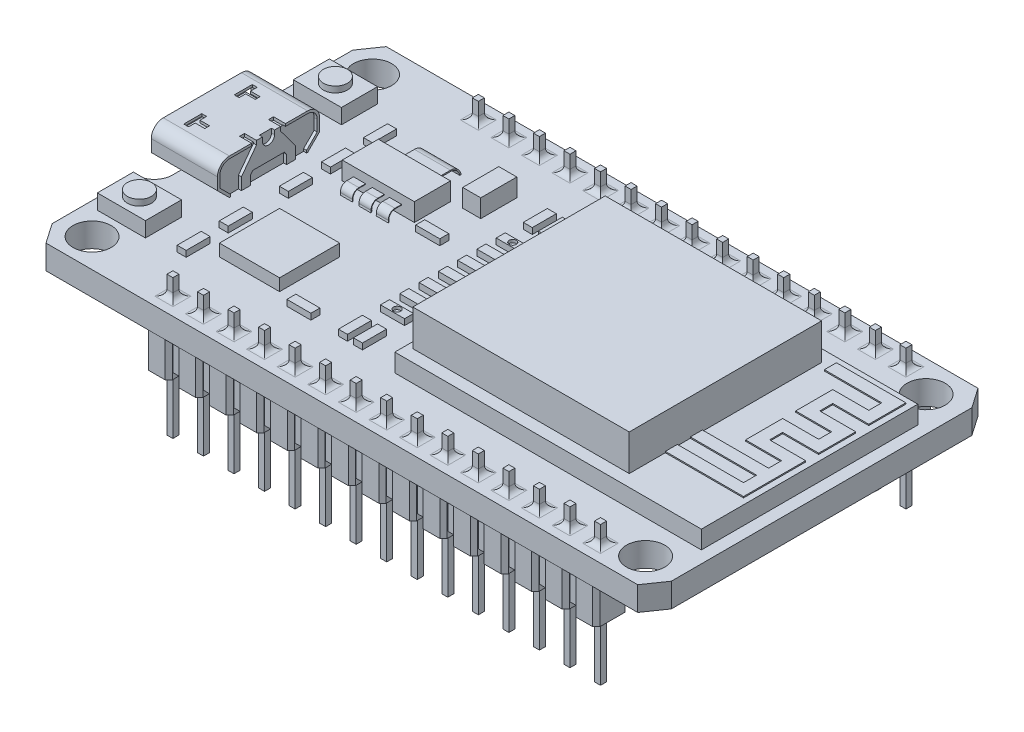
from build123d import *

# Parameters (mm, degrees)
CROQUIS1_W                = 51.5
CROQUIS1_H                = 28.3
SALIENTE_EXTRUIR1_DEPTH   = 2
CROQUIS2_R                = 1.5875
CORTAR_EXTRUIR1_DEPTH     = 2
CROQUIS13_OUTSIDE_W       = 65.26
CROQUIS13_OUTSIDE_H       = 42.06
CORTAR_EXTRUIR2_DEPTH     = 3
CROQUIS3_W                = 25.5
CROQUIS3_H                = 18
SALIENTE_EXTRUIR2_DEPTH   = 1.5
CROQUIS4_W                = 18
CROQUIS4_H                = 16
SALIENTE_EXTRUIR3_DEPTH   = 3
SALIENTE_EXTRUIR4_START   = -10
CROQUIS5_W                = 0.5
CROQUIS5_H                = 0.5
SALIENTE_EXTRUIR4_DEPTH   = 11.5875
CROQUIS6_W                = 2
CROQUIS6_H                = 2.7
SALIENTE_EXTRUIR5_DEPTH   = 3
CHAFL_N1_SIZE             = 0.3
REDONDEO2_R               = 0.5
MATRIZL1_COUNT            = 15
MATRIZL1_PITCH            = 2.54
CHAFL_N1_OF_MATRIZL1_SIZE = 0.3
REDONDEO2_OF_MATRIZL1_R   = 0.5
CROQUIS8_W                = 37.56
CROQUIS8_H                = 2
SALIENTE_EXTRUIR6_DEPTH   = 2.5
CROQUIS12_W               = 5.5
CROQUIS12_H               = 8.5
SALIENTE_EXTRUIR9_DEPTH   = 3
REDONDEO1_R               = 1
CORTAR_EXTRUIR3_DEPTH     = 6
CORTAR_EXTRUIR4_DEPTH     = 4
CORTAR_EXTRUIR5_START     = -0.25
CORTAR_EXTRUIR5_DEPTH     = 0.25
CROQUIS17_W               = 1
CROQUIS17_H               = 0.411065286
CORTAR_EXTRUIR6_DEPTH     = 0.25
CROQUIS18_W               = 5.68961293
CROQUIS18_H               = 0.758953995
SALIENTE_EXTRUIR10_DEPTH  = 3.25
CROQUIS19_W               = 4
CROQUIS19_H               = 3
SALIENTE_EXTRUIR11_DEPTH  = 1.25
CROQUIS22_R               = 1
SALIENTE_EXTRUIR13_DEPTH  = 0.5
CROQUIS23_W               = 0.75
CROQUIS23_H               = 2
CROQUIS23_W_2             = 2
CROQUIS23_H_2             = 0.75
SALIENTE_EXTRUIR14_DEPTH  = 0.5
CROQUIS26_W               = 5
CROQUIS26_H               = 5
SALIENTE_EXTRUIR15_DEPTH  = 1
CROQUIS27_W               = 1.5
CROQUIS27_H               = 3
SALIENTE_EXTRUIR16_DEPTH  = 1.5
CROQUIS28_W               = 6
CROQUIS28_H               = 3
SALIENTE_EXTRUIR17_DEPTH  = 1.5
SALIENTE_EXTRUIR18_DEPTH  = 0.1
CROQUIS31_R               = 0.3
CORTAR_EXTRUIR7_DEPTH     = 0.25
CROQUIS33_W               = 3
CROQUIS33_H               = 0.1
CROQUIS35_W               = 1
CROQUIS35_H               = 0.05
CORTAR_EXTRUIR8_DEPTH     = 0.5


with BuildPart() as part:
    # Croquis1 → Saliente-Extruir1 (new body)
    with BuildSketch(Plane(origin=(0, 0, 0), x_dir=(1, 0, 0), z_dir=(0, 1, 0))):
        Rectangle(CROQUIS1_W, CROQUIS1_H)
    extrude(amount=SALIENTE_EXTRUIR1_DEPTH)

    # Croquis2 → Cortar-Extruir1 (cut)
    with BuildSketch(Plane(origin=(0, 2, 0), x_dir=(1, 0, 0), z_dir=(0, 1, 0))):
        with Locations((-23.1625, 11.5625)):
            Circle(CROQUIS2_R)
        with Locations((22.875, 11.5625)):
            Circle(CROQUIS2_R)
        with Locations((-23.1625, -11.7625)):
            Circle(CROQUIS2_R)
        with Locations((22.875, -11.7625)):
            Circle(CROQUIS2_R)
    extrude(amount=-CORTAR_EXTRUIR1_DEPTH, mode=Mode.SUBTRACT)

    # Croquis13 outside → Cortar-Extruir2 (cut)
    with BuildSketch(Plane(origin=(0, 2, 0), x_dir=(1, 0, 0), z_dir=(0, 1, 0))):
        Rectangle(CROQUIS13_OUTSIDE_W, CROQUIS13_OUTSIDE_H)
        with BuildLine():
            Line((25.75, 12.5), (25.75, -12.5))
            Line((25.75, -12.5), (24.60625, -14.15))
            Line((24.60625, -14.15), (-24.60625, -14.15))
            Line((-24.60625, -14.15), (-25.75, -12.5))
            Line((-25.75, -12.5), (-25.75, -5.5))
            ThreePointArc((-25.75, -5.5), (-24.689339828, -5.060660172), (-24.25, -4))
            Line((-24.25, -4), (-24.25, 4))
            ThreePointArc((-24.25, 4), (-24.689339828, 5.060660172), (-25.75, 5.5))
            Line((-25.75, 5.5), (-25.75, 12.5))
            Line((-25.75, 12.5), (-24.60625, 14.15))
            Line((-24.60625, 14.15), (24.60625, 14.15))
            Line((24.60625, 14.15), (25.75, 12.5))
        make_face(mode=Mode.SUBTRACT)
    extrude(amount=-CORTAR_EXTRUIR2_DEPTH, mode=Mode.SUBTRACT)

    # Croquis3 → Saliente-Extruir2 (add)
    with BuildSketch(Plane(origin=(0, 2, 0), x_dir=(1, 0, 0), z_dir=(0, 1, 0))):
        with Locations((12, 0)):
            Rectangle(CROQUIS3_W, CROQUIS3_H)
    extrude(amount=SALIENTE_EXTRUIR2_DEPTH)

    # Croquis4 → Saliente-Extruir3 (add)
    with BuildSketch(Plane(origin=(0, 3.5, 0), x_dir=(1, 0, 0), z_dir=(0, 1, 0))):
        with Locations((8.75, 0)):
            Rectangle(CROQUIS4_W, CROQUIS4_H)
    extrude(amount=SALIENTE_EXTRUIR3_DEPTH)

    # Croquis5 → Saliente-Extruir4 (add)
    with BuildSketch(Plane(origin=(0, 2, 0), x_dir=(1, 0, 0), z_dir=(0, 1, 0)).offset(SALIENTE_EXTRUIR4_START)):
        with Locations((-15.5, 12.7)):
            Rectangle(CROQUIS5_W, CROQUIS5_H)
        with Locations((-15.5, -12.7)):
            Rectangle(CROQUIS5_W, CROQUIS5_H)
    saliente_extruir4 = extrude(amount=SALIENTE_EXTRUIR4_DEPTH)

    # Croquis6 → Saliente-Extruir5 (add)
    with BuildSketch(Plane.XZ):
        with Locations((-15.5, -12.7)):
            Rectangle(CROQUIS6_W, CROQUIS6_H)
        with Locations((-15.5, 12.7)):
            Rectangle(CROQUIS6_W, CROQUIS6_H)
    saliente_extruir5 = extrude(amount=SALIENTE_EXTRUIR5_DEPTH)

    # Chaflán1
    chafl_n1_edges = [part.edges().sort_by_distance(p)[0] for p in [
        (-16.5, -1.5, -14.05),
        (-16.5, -1.5, -11.35),
        (-14.5, -1.5, -11.35),
        (-14.5, -1.5, -14.05),
        (-16.5, -1.5, 11.35),
        (-14.5, -1.5, 11.35),
        (-14.5, -1.5, 14.05),
        (-16.5, -1.5, 14.05),
    ]]
    chamfer(chafl_n1_edges, length=CHAFL_N1_SIZE)

    # Redondeo2
    redondeo2_edges = [part.edges().sort_by_distance(p)[0] for p in [
        (-15.75, 2, -12.7),
        (-15.5, 2, -12.45),
        (-15.25, 2, -12.7),
        (-15.5, 2, -12.95),
        (-15.25, 2, 12.7),
        (-15.5, 2, 12.95),
        (-15.5, 2, 12.45),
        (-15.75, 2, 12.7),
    ]]
    fillet(redondeo2_edges, radius=REDONDEO2_R)

    # MatrizL1: Saliente-Extruir4, Saliente-Extruir5 ×15
    with Locations(*[(i * MATRIZL1_PITCH, 0, 0) for i in range(1, MATRIZL1_COUNT)]):
        add(saliente_extruir4)
        add(saliente_extruir5)

    # Chaflán1 of MatrizL1
    chafl_n1_of_matrizl1_edges = [part.edges().sort_by_distance(p)[0] for p in [
        (-13.96, -1.5, -14.05),
        (-13.96, -1.5, -11.35),
        (-11.96, -1.5, -11.35),
        (-11.96, -1.5, -14.05),
        (-13.96, -1.5, 11.35),
        (-11.96, -1.5, 11.35),
        (-11.96, -1.5, 14.05),
        (-13.96, -1.5, 14.05),
        (-11.42, -1.5, -14.05),
        (-11.42, -1.5, -11.35),
        (-9.42, -1.5, -11.35),
        (-9.42, -1.5, -14.05),
        (-11.42, -1.5, 11.35),
        (-9.42, -1.5, 11.35),
        (-9.42, -1.5, 14.05),
        (-11.42, -1.5, 14.05),
        (-8.88, -1.5, -14.05),
        (-8.88, -1.5, -11.35),
        (-6.88, -1.5, -11.35),
        (-6.88, -1.5, -14.05),
        (-8.88, -1.5, 11.35),
        (-6.88, -1.5, 11.35),
        (-6.88, -1.5, 14.05),
        (-8.88, -1.5, 14.05),
        (-6.34, -1.5, -14.05),
        (-6.34, -1.5, -11.35),
        (-4.34, -1.5, -11.35),
        (-4.34, -1.5, -14.05),
        (-6.34, -1.5, 11.35),
        (-4.34, -1.5, 11.35),
        (-4.34, -1.5, 14.05),
        (-6.34, -1.5, 14.05),
        (-3.8, -1.5, -14.05),
        (-3.8, -1.5, -11.35),
        (-1.8, -1.5, -11.35),
        (-1.8, -1.5, -14.05),
        (-3.8, -1.5, 11.35),
        (-1.8, -1.5, 11.35),
        (-1.8, -1.5, 14.05),
        (-3.8, -1.5, 14.05),
        (-1.26, -1.5, -14.05),
        (-1.26, -1.5, -11.35),
        (0.74, -1.5, -11.35),
        (0.74, -1.5, -14.05),
        (-1.26, -1.5, 11.35),
        (0.74, -1.5, 11.35),
        (0.74, -1.5, 14.05),
        (-1.26, -1.5, 14.05),
        (1.28, -1.5, -14.05),
        (1.28, -1.5, -11.35),
        (3.28, -1.5, -11.35),
        (3.28, -1.5, -14.05),
        (1.28, -1.5, 11.35),
        (3.28, -1.5, 11.35),
        (3.28, -1.5, 14.05),
        (1.28, -1.5, 14.05),
        (3.82, -1.5, -14.05),
        (3.82, -1.5, -11.35),
        (5.82, -1.5, -11.35),
        (5.82, -1.5, -14.05),
        (3.82, -1.5, 11.35),
        (5.82, -1.5, 11.35),
        (5.82, -1.5, 14.05),
        (3.82, -1.5, 14.05),
        (6.36, -1.5, -14.05),
        (6.36, -1.5, -11.35),
        (8.36, -1.5, -11.35),
        (8.36, -1.5, -14.05),
        (6.36, -1.5, 11.35),
        (8.36, -1.5, 11.35),
        (8.36, -1.5, 14.05),
        (6.36, -1.5, 14.05),
        (8.9, -1.5, -14.05),
        (8.9, -1.5, -11.35),
        (10.9, -1.5, -11.35),
        (10.9, -1.5, -14.05),
        (8.9, -1.5, 11.35),
        (10.9, -1.5, 11.35),
        (10.9, -1.5, 14.05),
        (8.9, -1.5, 14.05),
        (11.44, -1.5, -14.05),
        (11.44, -1.5, -11.35),
        (13.44, -1.5, -11.35),
        (13.44, -1.5, -14.05),
        (11.44, -1.5, 11.35),
        (13.44, -1.5, 11.35),
        (13.44, -1.5, 14.05),
        (11.44, -1.5, 14.05),
        (13.98, -1.5, -14.05),
        (13.98, -1.5, -11.35),
        (15.98, -1.5, -11.35),
        (15.98, -1.5, -14.05),
        (13.98, -1.5, 11.35),
        (15.98, -1.5, 11.35),
        (15.98, -1.5, 14.05),
        (13.98, -1.5, 14.05),
        (16.52, -1.5, -14.05),
        (16.52, -1.5, -11.35),
        (18.52, -1.5, -11.35),
        (18.52, -1.5, -14.05),
        (16.52, -1.5, 11.35),
        (18.52, -1.5, 11.35),
        (18.52, -1.5, 14.05),
        (16.52, -1.5, 14.05),
        (19.06, -1.5, -14.05),
        (19.06, -1.5, -11.35),
        (21.06, -1.5, -11.35),
        (21.06, -1.5, -14.05),
        (19.06, -1.5, 11.35),
        (21.06, -1.5, 11.35),
        (21.06, -1.5, 14.05),
        (19.06, -1.5, 14.05),
    ]]
    chamfer(chafl_n1_of_matrizl1_edges, length=CHAFL_N1_OF_MATRIZL1_SIZE)

    # Redondeo2 of MatrizL1
    redondeo2_of_matrizl1_edges = [part.edges().sort_by_distance(p)[0] for p in [
        (-13.21, 2, -12.7),
        (-12.96, 2, -12.45),
        (-12.71, 2, -12.7),
        (-12.96, 2, -12.95),
        (-12.71, 2, 12.7),
        (-12.96, 2, 12.95),
        (-12.96, 2, 12.45),
        (-13.21, 2, 12.7),
        (-10.67, 2, -12.7),
        (-10.42, 2, -12.45),
        (-10.17, 2, -12.7),
        (-10.42, 2, -12.95),
        (-10.17, 2, 12.7),
        (-10.42, 2, 12.95),
        (-10.42, 2, 12.45),
        (-10.67, 2, 12.7),
        (-8.13, 2, -12.7),
        (-7.88, 2, -12.45),
        (-7.63, 2, -12.7),
        (-7.88, 2, -12.95),
        (-7.63, 2, 12.7),
        (-7.88, 2, 12.95),
        (-7.88, 2, 12.45),
        (-8.13, 2, 12.7),
        (-5.59, 2, -12.7),
        (-5.34, 2, -12.45),
        (-5.09, 2, -12.7),
        (-5.34, 2, -12.95),
        (-5.09, 2, 12.7),
        (-5.34, 2, 12.95),
        (-5.34, 2, 12.45),
        (-5.59, 2, 12.7),
        (-3.05, 2, -12.7),
        (-2.8, 2, -12.45),
        (-2.55, 2, -12.7),
        (-2.8, 2, -12.95),
        (-2.55, 2, 12.7),
        (-2.8, 2, 12.95),
        (-2.8, 2, 12.45),
        (-3.05, 2, 12.7),
        (-0.51, 2, -12.7),
        (-0.26, 2, -12.45),
        (-0.01, 2, -12.7),
        (-0.26, 2, -12.95),
        (-0.01, 2, 12.7),
        (-0.26, 2, 12.95),
        (-0.26, 2, 12.45),
        (-0.51, 2, 12.7),
        (2.03, 2, -12.7),
        (2.28, 2, -12.45),
        (2.53, 2, -12.7),
        (2.28, 2, -12.95),
        (2.53, 2, 12.7),
        (2.28, 2, 12.95),
        (2.28, 2, 12.45),
        (2.03, 2, 12.7),
        (4.57, 2, -12.7),
        (4.82, 2, -12.45),
        (5.07, 2, -12.7),
        (4.82, 2, -12.95),
        (5.07, 2, 12.7),
        (4.82, 2, 12.95),
        (4.82, 2, 12.45),
        (4.57, 2, 12.7),
        (7.11, 2, -12.7),
        (7.36, 2, -12.45),
        (7.61, 2, -12.7),
        (7.36, 2, -12.95),
        (7.61, 2, 12.7),
        (7.36, 2, 12.95),
        (7.36, 2, 12.45),
        (7.11, 2, 12.7),
        (9.65, 2, -12.7),
        (9.9, 2, -12.45),
        (10.15, 2, -12.7),
        (9.9, 2, -12.95),
        (10.15, 2, 12.7),
        (9.9, 2, 12.95),
        (9.9, 2, 12.45),
        (9.65, 2, 12.7),
        (12.19, 2, -12.7),
        (12.44, 2, -12.45),
        (12.69, 2, -12.7),
        (12.44, 2, -12.95),
        (12.69, 2, 12.7),
        (12.44, 2, 12.95),
        (12.44, 2, 12.45),
        (12.19, 2, 12.7),
        (14.73, 2, -12.7),
        (14.98, 2, -12.45),
        (15.23, 2, -12.7),
        (14.98, 2, -12.95),
        (15.23, 2, 12.7),
        (14.98, 2, 12.95),
        (14.98, 2, 12.45),
        (14.73, 2, 12.7),
        (17.27, 2, -12.7),
        (17.52, 2, -12.45),
        (17.77, 2, -12.7),
        (17.52, 2, -12.95),
        (17.77, 2, 12.7),
        (17.52, 2, 12.95),
        (17.52, 2, 12.45),
        (17.27, 2, 12.7),
        (19.81, 2, -12.7),
        (20.06, 2, -12.45),
        (20.31, 2, -12.7),
        (20.06, 2, -12.95),
        (20.31, 2, 12.7),
        (20.06, 2, 12.95),
        (20.06, 2, 12.45),
        (19.81, 2, 12.7),
    ]]
    fillet(redondeo2_of_matrizl1_edges, radius=REDONDEO2_OF_MATRIZL1_R)

    # Croquis8 → Saliente-Extruir6 (add)
    with BuildSketch(Plane.XZ):
        with Locations((2.28, -12.7)):
            Rectangle(CROQUIS8_W, CROQUIS8_H)
        with Locations((2.28, 12.7)):
            Rectangle(CROQUIS8_W, CROQUIS8_H)
    extrude(amount=SALIENTE_EXTRUIR6_DEPTH)

    # Croquis12 → Saliente-Extruir9 (add)
    with BuildSketch(Plane(origin=(0, 2, 0), x_dir=(1, 0, 0), z_dir=(0, 1, 0))):
        with Locations((-23, 0)):
            Rectangle(CROQUIS12_W, CROQUIS12_H)
    extrude(amount=SALIENTE_EXTRUIR9_DEPTH)

    # Redondeo1
    redondeo1_edges = [part.edges().sort_by_distance(p)[0] for p in [
        (-23, 5, 4.25),
        (-23, 5, -4.25),
    ]]
    fillet(redondeo1_edges, radius=REDONDEO1_R)

    # Croquis14 → Cortar-Extruir3 (cut)
    with BuildSketch(Plane.ZY.offset(25.75)):
        Polygon((-4.25, 2), (-3.25, 2), (-4.25, 3), align=None)
        Polygon((4.25, 3), (3.25, 2), (4.25, 2), align=None)
    extrude(amount=-CORTAR_EXTRUIR3_DEPTH, mode=Mode.SUBTRACT)

    # Croquis15 → Cortar-Extruir4 (cut)
    with BuildSketch(Plane.ZY.offset(25.75)):
        with BuildLine():
            Line((-4.05, 3.082842712), (-3.167157288, 2.2))
            Line((-3.167157288, 2.2), (3.167157288, 2.2))
            Line((3.167157288, 2.2), (4.05, 3.082842712))
            Line((4.05, 3.082842712), (4.05, 4))
            ThreePointArc((4.05, 4), (3.815685425, 4.565685425), (3.25, 4.8))
            Line((3.25, 4.8), (-3.25, 4.8))
            ThreePointArc((-3.25, 4.8), (-3.815685425, 4.565685425), (-4.05, 4))
            Line((-4.05, 4), (-4.05, 3.082842712))
        make_face()
    extrude(amount=-CORTAR_EXTRUIR4_DEPTH, mode=Mode.SUBTRACT)

    # Croquis16 → Cortar-Extruir5 (cut)
    with BuildSketch(Plane(origin=(-20.25, 0, 0), x_dir=(0, 0, -1), z_dir=(1, 0, 0)).offset(CORTAR_EXTRUIR5_START)):
        Polygon((-1.5, 2.750073012), (-1.5, 2), (1.5, 2), (1.5, 2.750073012), (1.316867325, 2.994339073), (-1.316867325, 2.994339073), align=None)
        with BuildLine():
            Line((-2.25, 3), (-1, 4.667275256))
            Line((-1, 4.667275256), (-1, 5))
            Line((-1, 5), (-1.411065286, 5))
            Line((-1.411065286, 5), (-1.411065286, 4.8))
            Line((-1.411065286, 4.8), (-3.25, 4.8))
            ThreePointArc((-3.25, 4.8), (-3.815685425, 4.565685425), (-4.05, 4))
            Line((-4.05, 4), (-4.05, 3.082842712))
            Line((-4.05, 3.082842712), (-3.167157288, 2.2))
            Line((-3.167157288, 2.2), (-3.167157288, 2))
            Line((-3.167157288, 2), (-2.25, 2))
            Line((-2.25, 2), (-2.25, 3))
        make_face()
        with BuildLine():
            Line((-0.5, 5), (0.5, 5))
            Line((0.5, 5), (0.5, 4.667275256))
            ThreePointArc((0.5, 4.667275256), (0, 4.167275256), (-0.5, 4.667275256))
            Line((-0.5, 4.667275256), (-0.5, 5))
        make_face()
        with BuildLine():
            Line((3.167157288, 2.2), (3.167157288, 2))
            Line((3.167157288, 2), (2.25, 2))
            Line((2.25, 2), (2.25, 3))
            Line((2.25, 3), (1, 4.667275256))
            Line((1, 4.667275256), (1, 5))
            Line((1, 5), (1.411065286, 5))
            Line((1.411065286, 5), (1.411065286, 4.8))
            Line((1.411065286, 4.8), (3.25, 4.8))
            ThreePointArc((3.25, 4.8), (3.815685425, 4.565685425), (4.05, 4))
            Line((4.05, 4), (4.05, 3.082842712))
            Line((4.05, 3.082842712), (3.167157288, 2.2))
        make_face()
    extrude(amount=CORTAR_EXTRUIR5_DEPTH, mode=Mode.SUBTRACT)

    # Croquis17 → Cortar-Extruir6 (cut)
    with BuildSketch(Plane(origin=(0, 5, 0), x_dir=(1, 0, 0), z_dir=(0, 1, 0))):
        with Locations((-20.75, -1.205532643)):
            Rectangle(CROQUIS17_W, CROQUIS17_H)
        with Locations((-20.75, 1.205532643)):
            Rectangle(CROQUIS17_W, CROQUIS17_H)
    extrude(amount=-CORTAR_EXTRUIR6_DEPTH, mode=Mode.SUBTRACT)

    # Croquis18 → Saliente-Extruir10 (add)
    with BuildSketch(Plane.ZY.offset(21.75)):
        with Locations((0, 3.814056829)):
            Rectangle(CROQUIS18_W, CROQUIS18_H)
    extrude(amount=SALIENTE_EXTRUIR10_DEPTH)

    # Croquis19 → Saliente-Extruir11 (add)
    with BuildSketch(Plane(origin=(0, 2, 0), x_dir=(1, 0, 0), z_dir=(0, 1, 0))):
        with Locations((-22.837294818, -8.15)):
            Rectangle(CROQUIS19_W, CROQUIS19_H)
        with Locations((-22.837294818, 8.15)):
            Rectangle(CROQUIS19_W, CROQUIS19_H)
    extrude(amount=SALIENTE_EXTRUIR11_DEPTH)

    # Croquis22 → Saliente-Extruir13 (add)
    with BuildSketch(Plane(origin=(0, 3.25, 0), x_dir=(1, 0, 0), z_dir=(0, 1, 0))):
        with Locations((-22.837294818, 8.15)):
            Circle(CROQUIS22_R)
        with Locations((-22.837294818, -8.15)):
            Circle(CROQUIS22_R)
    extrude(amount=SALIENTE_EXTRUIR13_DEPTH)

    # Croquis23 → Saliente-Extruir14 (add)
    with BuildSketch(Plane(origin=(0, 2, 0), x_dir=(1, 0, 0), z_dir=(0, 1, 0))):
        with Locations((-18.125, 3.65)):
            Rectangle(CROQUIS23_W, CROQUIS23_H)
        with Locations((-18.125, 7.15)):
            Rectangle(CROQUIS23_W, CROQUIS23_H)
        with Locations((-18.125, 0.15)):
            Rectangle(CROQUIS23_W, CROQUIS23_H)
        with Locations((-18.125, -8.35)):
            Rectangle(CROQUIS23_W, CROQUIS23_H)
        with Locations((-18.125, -4.85)):
            Rectangle(CROQUIS23_W, CROQUIS23_H)
        with Locations((-4.75, 3.208333333)):
            Rectangle(CROQUIS23_W_2, CROQUIS23_H_2)
        with Locations((-4.75, 4.8125)):
            Rectangle(CROQUIS23_W_2, CROQUIS23_H_2)
        with Locations((-4.75, 1.604166667)):
            Rectangle(CROQUIS23_W_2, CROQUIS23_H_2)
        with Locations((-4.75, 0)):
            Rectangle(CROQUIS23_W_2, CROQUIS23_H_2)
        with Locations((-4.75, -1.604166667)):
            Rectangle(CROQUIS23_W_2, CROQUIS23_H_2)
        with Locations((-4.75, -3.208333333)):
            Rectangle(CROQUIS23_W_2, CROQUIS23_H_2)
        with Locations((-4.75, -4.8125)):
            Rectangle(CROQUIS23_W_2, CROQUIS23_H_2)
        with Locations((-4.125, -7.6875)):
            Rectangle(CROQUIS23_W, CROQUIS23_H)
        with Locations((-5.375, -7.6875)):
            Rectangle(CROQUIS23_W, CROQUIS23_H)
        with Locations((-4.125, 7.6875)):
            Rectangle(CROQUIS23_W, CROQUIS23_H)
        with Locations((-5.375, 7.6875)):
            Rectangle(CROQUIS23_W, CROQUIS23_H)
        with Locations((-9.0373377, -8.3125)):
            Rectangle(CROQUIS23_W_2, CROQUIS23_H_2)
        with Locations((-9.0373377, 2.40625)):
            Rectangle(CROQUIS23_W_2, CROQUIS23_H_2)
    extrude(amount=SALIENTE_EXTRUIR14_DEPTH)

    # Croquis26 → Saliente-Extruir15 (add)
    with BuildSketch(Plane(origin=(0, 2, 0), x_dir=(1, 0, 0), z_dir=(0, 1, 0))):
        with Locations((-13.89366885, -5.4375)):
            Rectangle(CROQUIS26_W, CROQUIS26_H)
    extrude(amount=SALIENTE_EXTRUIR15_DEPTH)

    # Croquis27 → Saliente-Extruir16 (add)
    with BuildSketch(Plane(origin=(0, 2, 0), x_dir=(1, 0, 0), z_dir=(0, 1, 0))):
        with Locations((-9.0373377, 7.1875)):
            Rectangle(CROQUIS27_W, CROQUIS27_H)
    extrude(amount=SALIENTE_EXTRUIR16_DEPTH)

    # Croquis28 → Saliente-Extruir17 (add)
    with BuildSketch(Plane(origin=(0, 2, 0), x_dir=(1, 0, 0), z_dir=(0, 1, 0))):
        with Locations((-13.76866885, 4.15)):
            Rectangle(CROQUIS28_W, CROQUIS28_H)
    extrude(amount=SALIENTE_EXTRUIR17_DEPTH)

    # Croquis30 → Saliente-Extruir18 (add)
    with BuildSketch(Plane(origin=(0, 3.5, 0), x_dir=(1, 0, 0), z_dir=(0, 1, 0))):
        Polygon((18.479746063, 7.5), (23.254418174, 7.5), (23.254418174, 6.416666667), (20.258739977, 6.416666667), (20.258739977, 3.333333333), (23.254418174, 3.333333333), (23.254418174, 2.25), (20.258739977, 2.25), (20.258739977, -0.833333333), (23.254418174, -0.833333333), (23.254418174, -1.916666667), (17.75, -1.916666667), (17.75, -2.916666667), (23.254418174, -2.916666667), (23.254418174, -4), (17.75, -4), (17.75, -5), (24.254418174, -5), (24.254418174, -2.416666667), (24.254418174, 0.166666667), (21.258739977, 0.166666667), (21.258739977, 1.25), (24.254418174, 1.25), (24.254418174, 4.333333333), (21.258739977, 4.333333333), (21.258739977, 5.416666667), (24.254418174, 5.416666667), (24.254418174, 8.5), (18.479746063, 8.5), align=None)
    extrude(amount=SALIENTE_EXTRUIR18_DEPTH)

    # Croquis31 → Cortar-Extruir7 (cut)
    with BuildSketch(Plane(origin=(0, 2.5, 0), x_dir=(1, 0, 0), z_dir=(0, 1, 0))):
        with Locations((-4.75, 4.8125)):
            Circle(CROQUIS31_R)
        with Locations((-4.75, -4.8125)):
            Circle(CROQUIS31_R)
    extrude(amount=-CORTAR_EXTRUIR7_DEPTH, mode=Mode.SUBTRACT)

    # Barrer1: sweep along a path in Croquis32
    with BuildLine(Plane.ZY.offset(13.76866885)) as barrer1_path:
        Line((-5.65, 2.75), (-7.153654608, 2.75))
        ThreePointArc((-7.153654608, 2.75), (-7.770370245, 2.494548019), (-8.025822226, 1.877832382))
    # Croquis33 → Barrer1 (sweep)
    with BuildSketch(Plane(origin=(0, 0, -5.65), x_dir=(-1, 0, 0), z_dir=(0, 0, -1))):
        with Locations((13.76866885, 2.714914663)):
            Rectangle(CROQUIS33_W, CROQUIS33_H)
    sweep(path=barrer1_path.line)

    # Barrer2: sweep along a path in Croquis34
    with BuildLine(Plane.ZY.offset(13.76866885)) as barrer2_path:
        Line((-2.65, 2.75), (-2.095942459, 2.75))
        ThreePointArc((-2.095942459, 2.75), (-1.707871888, 2.575411266), (-1.581097256, 2.16919927))
        ThreePointArc((-1.581097256, 2.16919927), (-1.436021267, 1.850627734), (-1.086379703, 1.833726789))
    # Croquis35 → Barrer2 (sweep)
    with BuildSketch(Plane.XY.offset(-2.65)):
        with Locations((-13.76866885, 2.748535406)):
            Rectangle(CROQUIS35_W, CROQUIS35_H)
        with Locations((-15.33116885, 2.736035406)):
            Rectangle(CROQUIS35_W, CROQUIS35_H)
        with Locations((-12.33116885, 2.748535406)):
            Rectangle(CROQUIS35_W, CROQUIS35_H)
    sweep(path=barrer2_path.line)

    # Croquis36 → Cortar-Extruir8 (cut)
    with BuildSketch(Plane(origin=(0, 5, 0), x_dir=(1, 0, 0), z_dir=(0, 1, 0))):
        Polygon((-24.05, -2.3), (-23.25, -2.3), (-23.25, -1.9), (-24.05, -1.9), (-24.05, -1.35), (-24.45, -1.35), (-24.45, -2.85), (-24.05, -2.85), align=None)
        Polygon((-24.05, 1.35), (-24.05, 1.9), (-23.25, 1.9), (-23.25, 2.3), (-24.05, 2.3), (-24.05, 2.85), (-24.45, 2.85), (-24.45, 1.35), align=None)
    extrude(amount=-CORTAR_EXTRUIR8_DEPTH, mode=Mode.SUBTRACT)


solid = part.part
